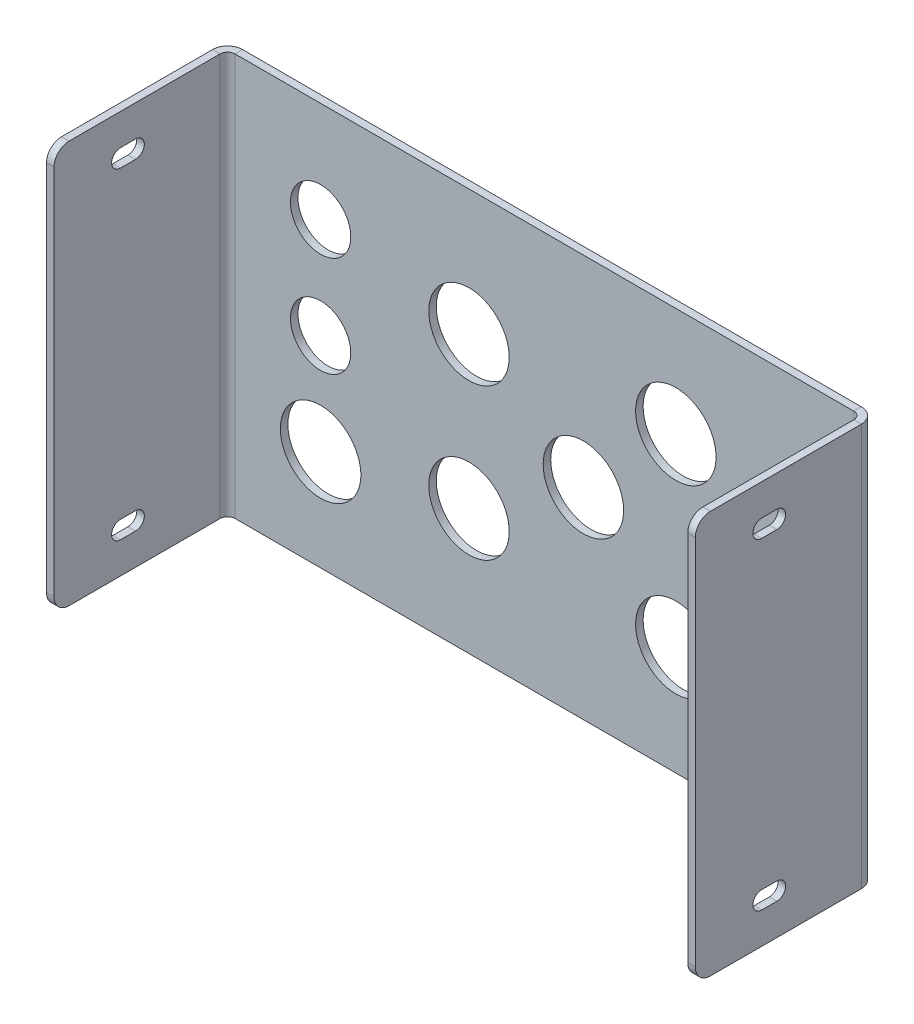
from build123d import *

# Parameters (mm, degrees)
FLANGE_BASE1_DEPTH    = 40
ESBO_O4_R             = 6
ESBO_O4_R_2           = 8
CORTE_EXTRUS_O1_DEPTH = 1.5
FILETE1_R             = 3
CORTE_EXTRUS_O2_DEPTH = 140.396018595


# Sheet-metal steps are written as plain solids
with BuildPart() as part:
    # Esboço2 → Flange-base1 (new, symmetric)
    with BuildSketch(Plane(origin=(0, 0, 0), x_dir=(1, 0, 0), z_dir=(0, 1, 0))):
        with BuildLine():
            Line((-63, -34.5), (-63, -1.5))
            ThreePointArc((-63, -1.5), (-62.560660172, -0.439339828), (-61.5, 0))
            Line((-61.5, 0), (61.5, 0))
            ThreePointArc((61.5, 0), (62.560660172, -0.439339828), (63, -1.5))
            Line((63, -1.5), (63, -34.5))
            Line((63, -34.5), (64.5, -34.5))
            Line((64.5, -34.5), (64.5, -1.5))
            ThreePointArc((64.5, -1.5), (63.621320344, 0.621320344), (61.5, 1.5))
            Line((61.5, 1.5), (-61.5, 1.5))
            ThreePointArc((-61.5, 1.5), (-63.621320344, 0.621320344), (-64.5, -1.5))
            Line((-64.5, -1.5), (-64.5, -34.5))
            Line((-64.5, -34.5), (-63, -34.5))
        make_face()
    extrude(amount=FLANGE_BASE1_DEPTH, both=True)

    # Esboço4 → Corte-extrusão1 (cut)
    with BuildSketch(Plane(origin=(0, 0, -1.5), x_dir=(-1, 0, 0), z_dir=(0, 0, -1))):
        with Locations((44.5, 0)):
            Circle(ESBO_O4_R)
        with Locations((44.5, -20)):
            Circle(ESBO_O4_R_2)
        with Locations((44.5, 20)):
            Circle(ESBO_O4_R)
        with Locations((15, 15)):
            Circle(ESBO_O4_R_2)
        with Locations((-44.5, 0)):
            Circle(ESBO_O4_R_2)
        with Locations((-26.124574835, 18.375425165)):
            Circle(ESBO_O4_R_2)
        with Locations((-7.74914967, 0)):
            Circle(ESBO_O4_R_2)
        with Locations((-26.124574835, -18.375425165)):
            Circle(ESBO_O4_R_2)
        with Locations((15, -15)):
            Circle(ESBO_O4_R_2)
    extrude(amount=-CORTE_EXTRUS_O1_DEPTH, mode=Mode.SUBTRACT)

    # Filete1
    filete1_edges = [part.edges().sort_by_distance(p)[0] for p in [
        (63.75, -40, 34.5),
        (-63.75, -40, 34.5),
        (63.75, 40, 34.5),
        (-63.75, 40, 34.5),
    ]]
    fillet(filete1_edges, radius=FILETE1_R)

    # Esboço5 → Corte-extrusão2 (cut, through all)
    with BuildSketch(Plane.ZY.offset(64.5)):
        with BuildLine():
            Line((18.3, 33.75), (21.3, 33.75))
            ThreePointArc((21.3, 33.75), (23.05, 32), (21.3, 30.25))
            Line((21.3, 30.25), (18.3, 30.25))
            ThreePointArc((18.3, 30.25), (16.55, 32), (18.3, 33.75))
        make_face()
        with BuildLine():
            Line((18.3, -30.25), (21.3, -30.25))
            ThreePointArc((21.3, -30.25), (23.05, -32), (21.3, -33.75))
            Line((21.3, -33.75), (18.3, -33.75))
            ThreePointArc((18.3, -33.75), (16.55, -32), (18.3, -30.25))
        make_face()
    extrude(amount=-CORTE_EXTRUS_O2_DEPTH, mode=Mode.SUBTRACT)


solid = part.part
